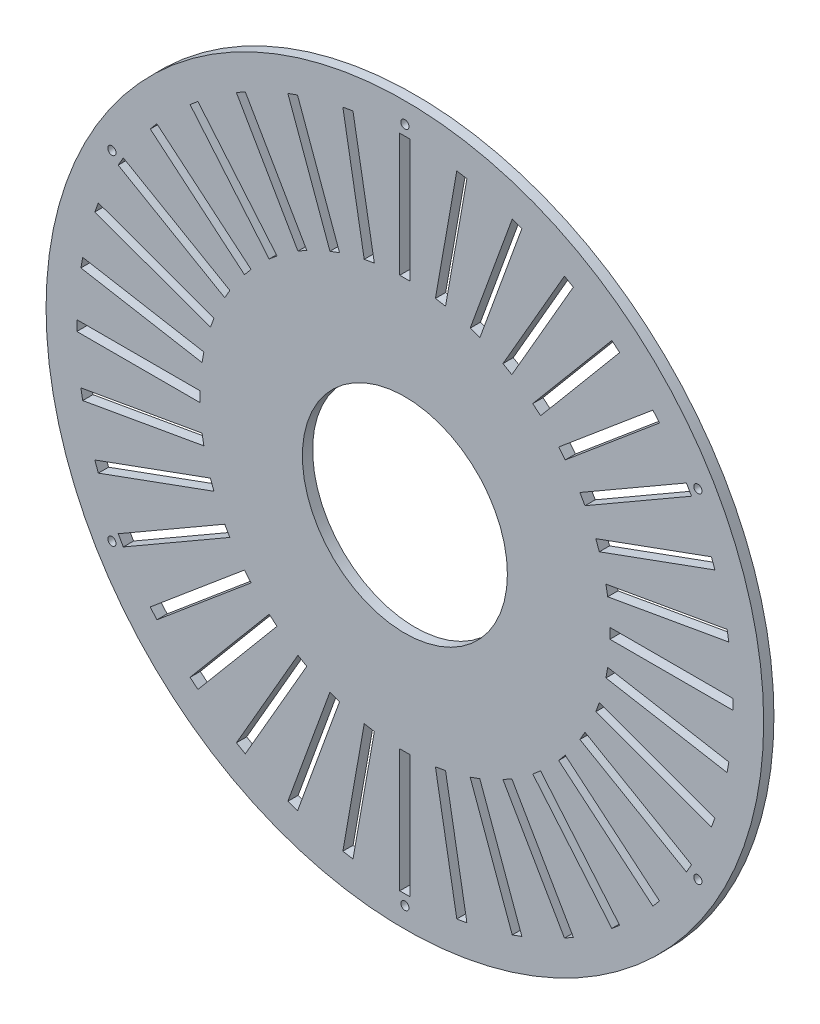
from build123d import *

# Parameters (mm, degrees)
BOSS_EXTRU_1_OUTLINE_R   = 175
BOSS_EXTRU_1_OUTLINE_W   = 5
BOSS_EXTRU_1_OUTLINE_H   = 60
BOSS_EXTRU_1_OUTLINE_W_2 = 60
BOSS_EXTRU_1_OUTLINE_H_2 = 5
BOSS_EXTRU_1_OUTLINE_R_2 = 50
BOSS_EXTRU_1_DEPTH       = 5
ESQUISSE2_R              = 2
ENL_V_MAT_EXTRU_1_DEPTH  = 10


# Read off the part's stored shape, not the designer's step: Boss.-Extru.1
with BuildPart() as part:
    # Boss.-Extru.1 outline → Boss.-Extru.1 (new body)
    with BuildSketch(Plane.XY):
        Circle(BOSS_EXTRU_1_OUTLINE_R)
        Polygon((-31.852782781, -94.824312437), (-52.37399138, -151.205869684), (-57.072454484, -149.495768967), (-36.551245885, -93.11421172), align=None, mode=Mode.SUBTRACT)
        Polygon((-47.834936491, -87.852540378), (-77.834936491, -139.814064606), (-82.165063509, -137.314064606), (-52.165063509, -85.352540378), align=None, mode=Mode.SUBTRACT)
        Polygon((-62.363649861, -78.211413336), (-100.930906442, -124.174079923), (-104.761128658, -120.960141875), (-66.193872076, -74.997475288), align=None, mode=Mode.SUBTRACT)
        Polygon((-14.902798384, -98.914895745), (-25.321689044, -158.003360926), (-30.245727809, -157.135120038), (-19.826837149, -98.046654857), align=None, mode=Mode.SUBTRACT)
        Polygon((-74.997475288, -66.193872076), (-120.960141875, -104.761128658), (-124.174079923, -100.930906442), (-78.211413336, -62.363649861), align=None, mode=Mode.SUBTRACT)
        Polygon((-85.352540378, -52.165063509), (-137.314064606, -82.165063509), (-139.814064606, -77.834936491), (-87.852540378, -47.834936491), align=None, mode=Mode.SUBTRACT)
        Polygon((-93.11421172, -36.551245885), (-149.495768967, -57.072454484), (-151.205869684, -52.37399138), (-94.824312437, -31.852782781), align=None, mode=Mode.SUBTRACT)
        Polygon((-98.046654857, -19.826837149), (-157.135120038, -30.245727809), (-158.003360926, -25.321689044), (-98.914895745, -14.902798384), align=None, mode=Mode.SUBTRACT)
        with Locations((0, -130)):
            Rectangle(BOSS_EXTRU_1_OUTLINE_W, BOSS_EXTRU_1_OUTLINE_H, mode=Mode.SUBTRACT)
        Polygon((19.826837149, -98.046654857), (30.245727809, -157.135120038), (25.321689044, -158.003360926), (14.902798384, -98.914895745), align=None, mode=Mode.SUBTRACT)
        Polygon((36.551245885, -93.11421172), (57.072454484, -149.495768967), (52.37399138, -151.205869684), (31.852782781, -94.824312437), align=None, mode=Mode.SUBTRACT)
        Polygon((52.165063509, -85.352540378), (82.165063509, -137.314064606), (77.834936491, -139.814064606), (47.834936491, -87.852540378), align=None, mode=Mode.SUBTRACT)
        Polygon((66.193872076, -74.997475288), (104.761128658, -120.960141875), (100.930906442, -124.174079923), (62.363649861, -78.211413336), align=None, mode=Mode.SUBTRACT)
        Polygon((78.211413336, -62.363649861), (124.174079923, -100.930906442), (120.960141875, -104.761128658), (74.997475288, -66.193872076), align=None, mode=Mode.SUBTRACT)
        Polygon((87.852540378, -47.834936491), (139.814064606, -77.834936491), (137.314064606, -82.165063509), (85.352540378, -52.165063509), align=None, mode=Mode.SUBTRACT)
        Polygon((94.824312437, -31.852782781), (151.205869684, -52.37399138), (149.495768967, -57.072454484), (93.11421172, -36.551245885), align=None, mode=Mode.SUBTRACT)
        Polygon((98.914895745, -14.902798384), (158.003360926, -25.321689044), (157.135120038, -30.245727809), (98.046654857, -19.826837149), align=None, mode=Mode.SUBTRACT)
        with Locations((-130, 0)):
            Rectangle(BOSS_EXTRU_1_OUTLINE_W_2, BOSS_EXTRU_1_OUTLINE_H_2, mode=Mode.SUBTRACT)
        Polygon((-98.914895745, 14.902798384), (-158.003360926, 25.321689044), (-157.135120038, 30.245727809), (-98.046654857, 19.826837149), align=None, mode=Mode.SUBTRACT)
        Polygon((-94.824312437, 31.852782781), (-151.205869684, 52.37399138), (-149.495768967, 57.072454484), (-93.11421172, 36.551245885), align=None, mode=Mode.SUBTRACT)
        Polygon((-87.852540378, 47.834936491), (-139.814064606, 77.834936491), (-137.314064606, 82.165063509), (-85.352540378, 52.165063509), align=None, mode=Mode.SUBTRACT)
        Polygon((-78.211413336, 62.363649861), (-124.174079923, 100.930906442), (-120.960141875, 104.761128658), (-74.997475288, 66.193872076), align=None, mode=Mode.SUBTRACT)
        Polygon((-66.193872076, 74.997475288), (-104.761128658, 120.960141875), (-100.930906442, 124.174079923), (-62.363649861, 78.211413336), align=None, mode=Mode.SUBTRACT)
        Polygon((-52.165063509, 85.352540378), (-82.165063509, 137.314064606), (-77.834936491, 139.814064606), (-47.834936491, 87.852540378), align=None, mode=Mode.SUBTRACT)
        Polygon((-36.551245885, 93.11421172), (-57.072454484, 149.495768967), (-52.37399138, 151.205869684), (-31.852782781, 94.824312437), align=None, mode=Mode.SUBTRACT)
        Polygon((-19.826837149, 98.046654857), (-30.245727809, 157.135120038), (-25.321689044, 158.003360926), (-14.902798384, 98.914895745), align=None, mode=Mode.SUBTRACT)
        Circle(BOSS_EXTRU_1_OUTLINE_R_2, mode=Mode.SUBTRACT)
        with Locations((130, 0)):
            Rectangle(BOSS_EXTRU_1_OUTLINE_W_2, BOSS_EXTRU_1_OUTLINE_H_2, mode=Mode.SUBTRACT)
        Polygon((98.046654857, 19.826837149), (157.135120038, 30.245727809), (158.003360926, 25.321689044), (98.914895745, 14.902798384), align=None, mode=Mode.SUBTRACT)
        Polygon((93.11421172, 36.551245885), (149.495768967, 57.072454484), (151.205869684, 52.37399138), (94.824312437, 31.852782781), align=None, mode=Mode.SUBTRACT)
        Polygon((85.352540378, 52.165063509), (137.314064606, 82.165063509), (139.814064606, 77.834936491), (87.852540378, 47.834936491), align=None, mode=Mode.SUBTRACT)
        Polygon((74.997475288, 66.193872076), (120.960141875, 104.761128658), (124.174079923, 100.930906442), (78.211413336, 62.363649861), align=None, mode=Mode.SUBTRACT)
        with Locations((0, 130)):
            Rectangle(BOSS_EXTRU_1_OUTLINE_W, BOSS_EXTRU_1_OUTLINE_H, mode=Mode.SUBTRACT)
        Polygon((14.902798384, 98.914895745), (25.321689044, 158.003360926), (30.245727809, 157.135120038), (19.826837149, 98.046654857), align=None, mode=Mode.SUBTRACT)
        Polygon((62.363649861, 78.211413336), (100.930906442, 124.174079923), (104.761128658, 120.960141875), (66.193872076, 74.997475288), align=None, mode=Mode.SUBTRACT)
        Polygon((47.834936491, 87.852540378), (77.834936491, 139.814064606), (82.165063509, 137.314064606), (52.165063509, 85.352540378), align=None, mode=Mode.SUBTRACT)
        Polygon((31.852782781, 94.824312437), (52.37399138, 151.205869684), (57.072454484, 149.495768967), (36.551245885, 93.11421172), align=None, mode=Mode.SUBTRACT)
    extrude(amount=BOSS_EXTRU_1_DEPTH)

    # Esquisse2 → Enlèv. mat.-Extru.1 (cut)
    with BuildSketch(Plane.XY.offset(5)):
        with Locations((0, 165)):
            Circle(ESQUISSE2_R)
        with Locations((142.894191624, 82.5)):
            Circle(ESQUISSE2_R)
        with Locations((142.894191624, -82.5)):
            Circle(ESQUISSE2_R)
        with Locations((0, -165)):
            Circle(ESQUISSE2_R)
        with Locations((-142.894191624, -82.5)):
            Circle(ESQUISSE2_R)
        with Locations((-142.894191624, 82.5)):
            Circle(ESQUISSE2_R)
    extrude(amount=-ENL_V_MAT_EXTRU_1_DEPTH, mode=Mode.SUBTRACT)


solid = part.part
